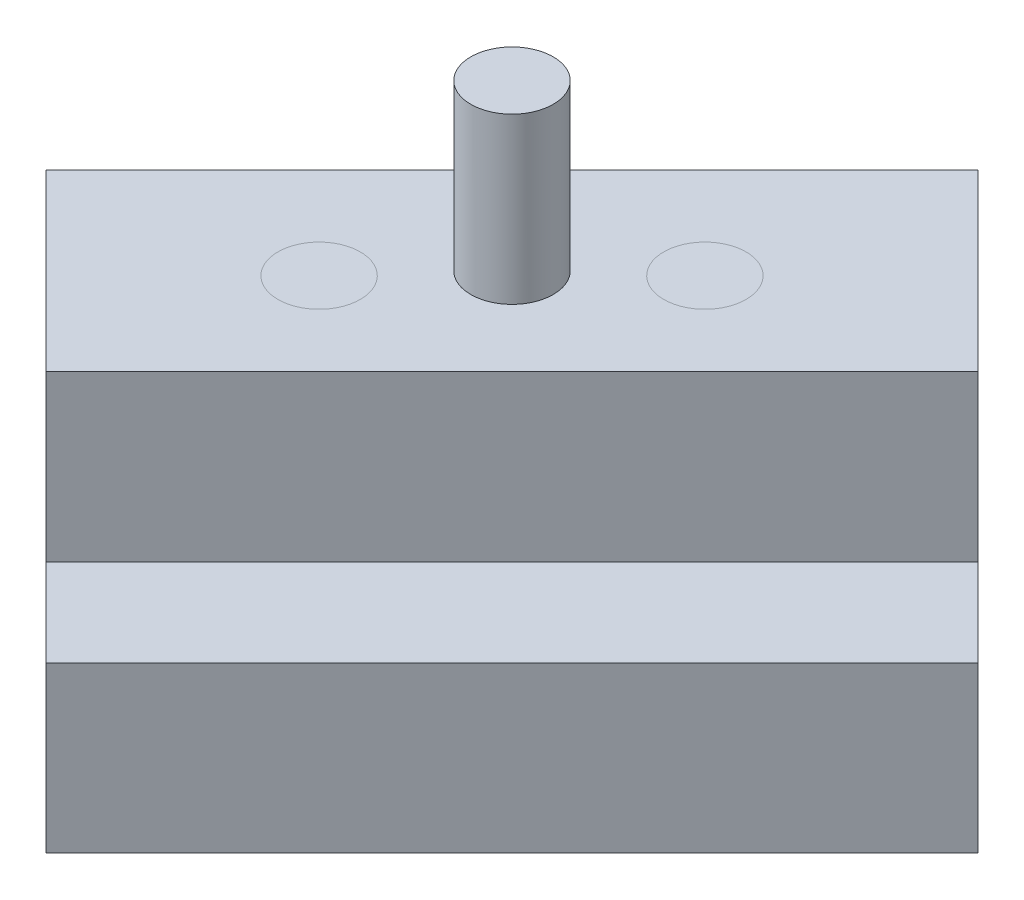
from build123d import *

# Parameters (mm, degrees)
BOSS_EXTRUDE1_DEPTH   = 25.4
SKETCH21_R            = 3.175
BOSS_EXTRUDE2_DEPTH   = 12.7
BODY_MOVE_COPY1_ANGLE = 45


with BuildPart() as part:
    # Sketch1 → Boss-Extrude1 (new, symmetric)
    with BuildSketch(Plane(origin=(0, 0, 0), x_dir=(0, 0, -1), z_dir=(1, 0, 0))):
        Polygon((101.6, 167.392101803), (111.125, 167.392101803), (111.125, 180.092101803), (130.175, 180.092101803), (130.175, 154.692101803), (101.6, 154.692101803), align=None)
    extrude(amount=BOSS_EXTRUDE1_DEPTH, both=True)

    # Sketch21 → Boss-Extrude2 (add)
    with BuildSketch(Plane(origin=(0, 180.092101803, 0), x_dir=(1, 0, 0), z_dir=(0, 1, 0))):
        with Locations((0, 120.65)):
            Circle(SKETCH21_R)
    extrude(amount=BOSS_EXTRUDE2_DEPTH)


with BuildPart() as part_1:
    # Body-Move/Copy1: moved
    add(part.part.rotate(Axis((0, 0, 0), (0, 1, 0)), BODY_MOVE_COPY1_ANGLE))


solid = part_1.part
